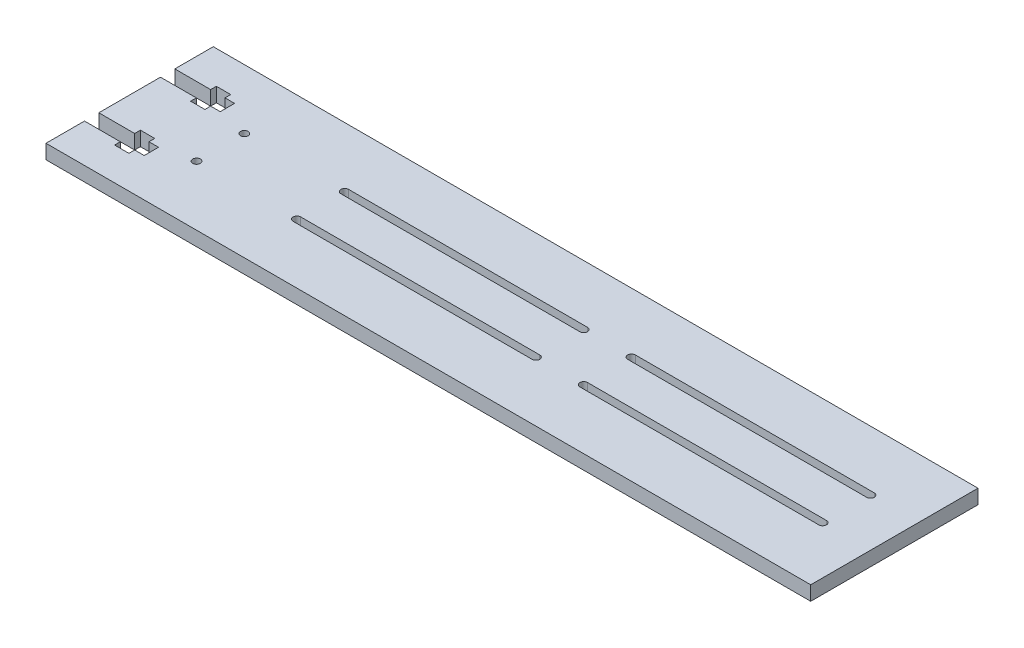
from build123d import *

# Parameters (mm, degrees)
SKETCH1_W           = 320
SKETCH1_H           = 70
BOSS_EXTRUDE1_DEPTH = 6
CUT_EXTRUDE2_DEPTH  = 164.893257946
CUT_EXTRUDE3_DEPTH  = 164.893257946
SKETCH6_R           = 1.6
CUT_EXTRUDE4_DEPTH  = 164.893257946


with BuildPart() as part:
    # Sketch1 → Boss-Extrude1 (new body)
    with BuildSketch(Plane(origin=(0, 0, 0), x_dir=(1, 0, 0), z_dir=(0, 1, 0))):
        Rectangle(SKETCH1_W, SKETCH1_H)
    extrude(amount=BOSS_EXTRUDE1_DEPTH)

    # Sketch3 → Cut-Extrude2 (cut, through all)
    with BuildSketch(Plane(origin=(0, 6, 0), x_dir=(1, 0, 0), z_dir=(0, 1, 0))):
        Polygon((-160, 12.9), (-145, 12.9), (-145, 10.5), (-139, 10.5), (-139, 12.9), (-135, 12.9), (-135, 18.9), (-139, 18.9), (-139, 21.3), (-145, 21.3), (-145, 18.9), (-160, 18.9), align=None)
        Polygon((-145, -18.9), (-145, -21.3), (-139, -21.3), (-139, -18.9), (-135, -18.9), (-135, -12.9), (-139, -12.9), (-139, -10.5), (-145, -10.5), (-145, -12.9), (-160, -12.9), (-160, -18.9), align=None)
    extrude(amount=-CUT_EXTRUDE2_DEPTH, mode=Mode.SUBTRACT)

    # Sketch5 → Cut-Extrude3 (cut, through all)
    with BuildSketch(Plane(origin=(0, 6, 0), x_dir=(1, 0, 0), z_dir=(0, 1, 0))):
        with BuildLine():
            Line((40, -8.4), (140, -8.4))
            ThreePointArc((140, -8.4), (141.6, -10), (140, -11.6))
            Line((140, -11.6), (40, -11.6))
            ThreePointArc((40, -11.6), (38.4, -10), (40, -8.4))
        make_face()
        with BuildLine():
            Line((-80, -8.4), (20, -8.4))
            ThreePointArc((20, -8.4), (21.6, -10), (20, -11.6))
            Line((20, -11.6), (-80, -11.6))
            ThreePointArc((-80, -11.6), (-81.6, -10), (-80, -8.4))
        make_face()
        with BuildLine():
            Line((-80, 11.6), (20, 11.6))
            ThreePointArc((20, 11.6), (21.6, 10), (20, 8.4))
            Line((20, 8.4), (-80, 8.4))
            ThreePointArc((-80, 8.4), (-81.6, 10), (-80, 11.6))
        make_face()
        with BuildLine():
            Line((40, 11.6), (140, 11.6))
            ThreePointArc((140, 11.6), (141.6, 10), (140, 8.4))
            Line((140, 8.4), (40, 8.4))
            ThreePointArc((40, 8.4), (38.4, 10), (40, 11.6))
        make_face()
    extrude(amount=-CUT_EXTRUDE3_DEPTH, mode=Mode.SUBTRACT)

    # Sketch6 → Cut-Extrude4 (cut, through all)
    with BuildSketch(Plane.XZ):
        with Locations((-122, -10)):
            Circle(SKETCH6_R)
        with Locations((-122, 10)):
            Circle(SKETCH6_R)
    extrude(amount=-CUT_EXTRUDE4_DEPTH, mode=Mode.SUBTRACT)


solid = part.part
